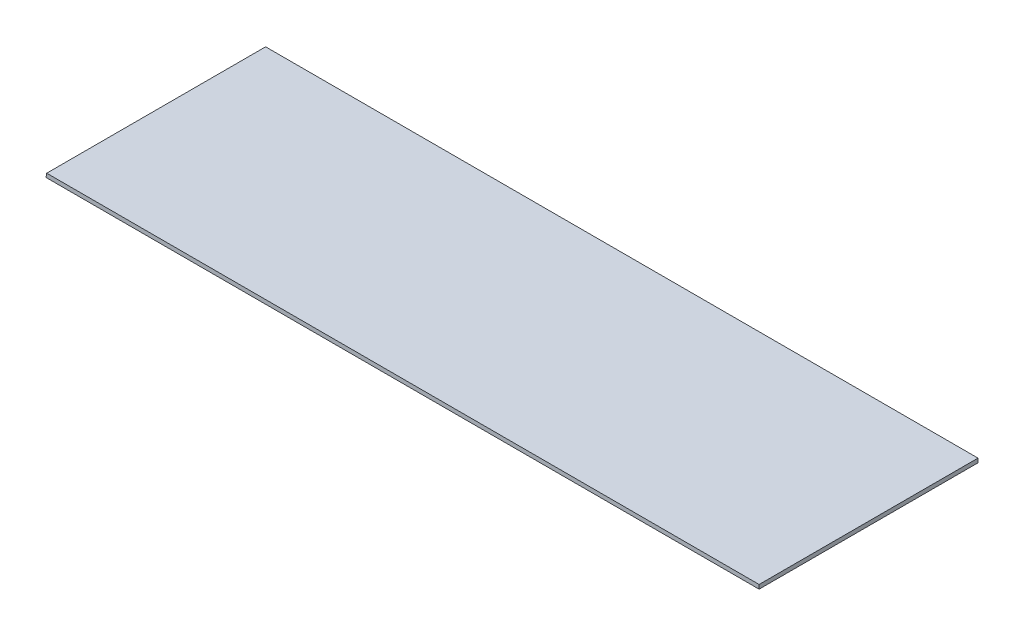
from build123d import *

# Parameters (mm, degrees)
SKETCH_1_W       = 350
SKETCH_1_H       = 107
EXTRUDE_1_DEPTH  = 2
CHAMFER_1_SIZE   = 10
CHAMFER_1_SIZE_2 = 1.763269807


with BuildPart() as part:
    # 草图1 → 凸台-拉伸1 (new body)
    with BuildSketch(Plane(origin=(0, 0, 0), x_dir=(1, 0, 0), z_dir=(0, 1, 0))):
        with Locations((132.989105515, 30.394008033)):
            Rectangle(SKETCH_1_W, SKETCH_1_H)
    extrude(amount=EXTRUDE_1_DEPTH)

    # 倒角1
    # the kernel refuses this chamfer: 10, 1.763269807 mm, written as the material it takes off along each edge
    with BuildSketch(Plane(origin=(-42.010894485, 2, 49.091379931), x_dir=(-0.006682531656101416, -0.9999776716360547, 0), z_dir=(0, 0, -1))) as chamfer_1_piece_1:
        Polygon((CHAMFER_1_SIZE * 0.999977671636, -CHAMFER_1_SIZE * 0.0066825316561), (-CHAMFER_1_SIZE_2 * 0.00668253165642, -CHAMFER_1_SIZE_2 * 0.999977671684), (0, 0), align=None)
    extrude(amount=158.970775928, mode=Mode.SUBTRACT)


solid = part.part
